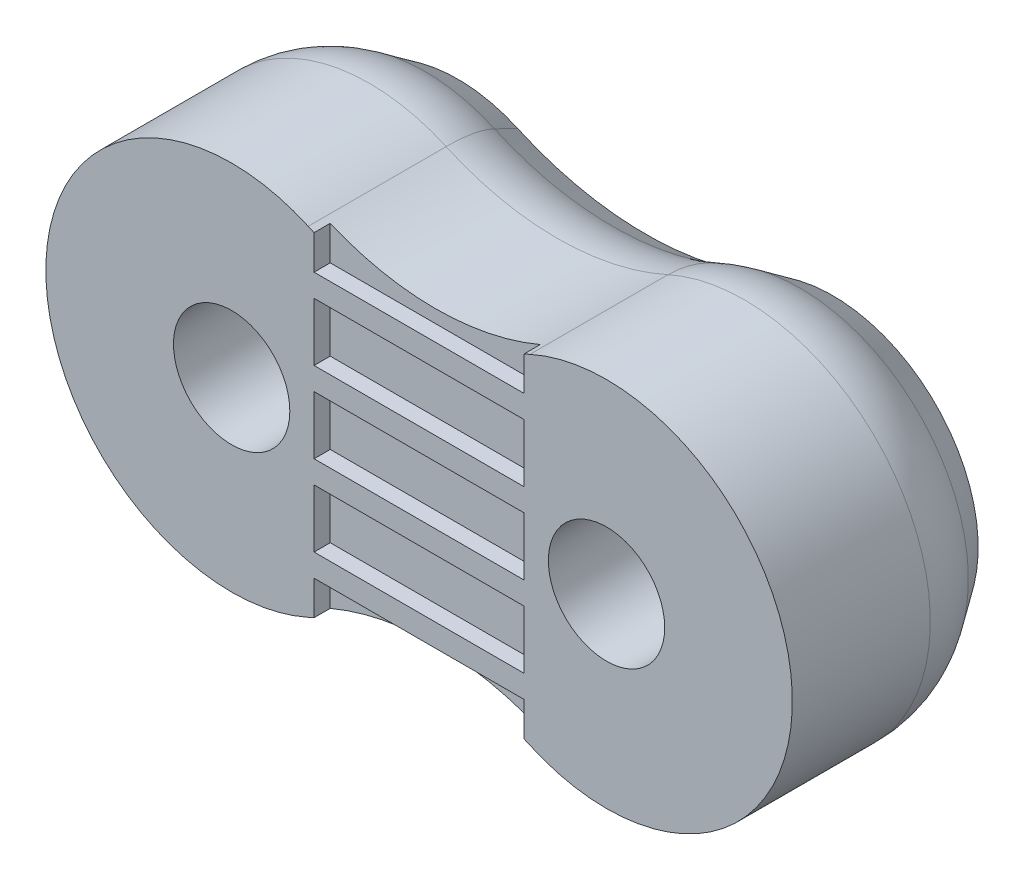
from build123d import *

# Parameters (mm, degrees)
BOSS_EXTRUDE1_DEPTH = 7
SKETCH5_R           = 1.799999865
SKETCH5_R_2         = 1.8
CUT_EXTRUDE4_DEPTH  = 18.482133737
SKETCH2_W           = 6.5
SKETCH2_H           = 1.8
CUT_EXTRUDE1_DEPTH  = 0.5
CUT_EXTRUDE5_DEPTH  = 2.5
CHAMFER1_SIZE       = 1.25
CHAMFER1_SIZE2      = 1.785185008
FILLET1_R           = 3
BOSS_EXTRUDE2_START = -0.6
SKETCH7_R           = 1.799999865
SKETCH7_R_2         = 1.8
BOSS_EXTRUDE2_DEPTH = 0.6
SKETCH8_R           = 1.399999865
SKETCH8_R_2         = 0.599999865
SKETCH8_R_3         = 1.4
SKETCH8_R_4         = 0.6
BOSS_EXTRUDE3_DEPTH = 2.5


with BuildPart() as part:
    # Sketch1 → Boss-Extrude1 (new body)
    with BuildSketch(Plane.XY):
        with BuildLine():
            ThreePointArc((6.631560259, -5.739560401), (3.2, -5), (-0.231560259, -5.739560401))
            ThreePointArc((-0.231560259, -5.739560401), (-8.35, -0.5), (-0.231560259, 4.739560401))
            ThreePointArc((-0.231560259, 4.739560401), (3.2, 4), (6.631560259, 4.739560401))
            ThreePointArc((6.631560259, 4.739560401), (14.75, -0.5), (6.631560259, -5.739560401))
        make_face()
    extrude(amount=-BOSS_EXTRUDE1_DEPTH)

    # Sketch5 → Cut-Extrude4 (cut, through all)
    with BuildSketch(Plane.XY):
        with Locations((9, -0.5)):
            Circle(SKETCH5_R)
        with Locations((-2.6, -0.5)):
            Circle(SKETCH5_R_2)
    extrude(amount=-CUT_EXTRUDE4_DEPTH, mode=Mode.SUBTRACT)

    # Sketch2 → Cut-Extrude1 (cut)
    with BuildSketch(Plane.XY):
        with Locations((3.200000135, 2)):
            Rectangle(SKETCH2_W, SKETCH2_H)
        with Locations((3.200000135, -0.5)):
            Rectangle(SKETCH2_W, SKETCH2_H)
        with BuildLine():
            Line((6.450000135, -4.6), (-0.049999865, -4.6))
            Line((-0.049999865, -4.6), (-0.049999865, -5.660076856))
            ThreePointArc((-0.049999865, -5.660076856), (3.200000146, -5), (6.450000135, -5.660076971))
            Line((6.450000135, -5.660076971), (6.450000135, -4.6))
        make_face()
        with Locations((3.200000135, -3)):
            Rectangle(SKETCH2_W, SKETCH2_H)
        with BuildLine():
            Line((6.450000135, 3.6), (6.450000135, 4.660076971))
            ThreePointArc((6.450000135, 4.660076971), (3.200000146, 4), (-0.049999865, 4.660076856))
            Line((-0.049999865, 4.660076856), (-0.049999865, 3.6))
            Line((-0.049999865, 3.6), (6.450000135, 3.6))
        make_face()
    extrude(amount=-CUT_EXTRUDE1_DEPTH, mode=Mode.SUBTRACT)

    # Sketch6 → Cut-Extrude5 (cut)
    with BuildSketch(Plane(origin=(0, 0, -7), x_dir=(-1, 0, 0), z_dir=(0, 0, -1))):
        Polygon((-0.979571669, -0.5), (0.810214166, -3.6), (4.389785834, -3.6), (6.179571669, -0.5), (4.389785834, 2.6), (0.810214166, 2.6), align=None)
        Polygon((-5.420428331, -0.5), (-7.210214166, 2.6), (-10.789785834, 2.6), (-12.579571669, -0.5), (-10.789785834, -3.6), (-7.210214166, -3.6), align=None)
    extrude(amount=-CUT_EXTRUDE5_DEPTH, mode=Mode.SUBTRACT)

    # Chamfer1
    chamfer1_edges = [part.edges().sort_by_distance(p)[0] for p in [
        (-8.35, -0.5, -7),
        (3.2, -5, -7),
        (14.75, -0.5, -7),
        (3.2, 4, -7),
    ]]
    chamfer1_side = [part.faces().sort_by_distance(p)[0] for p in [
        (3.2, -0.5, -7),
    ]]
    chamfer(chamfer1_edges, length=CHAMFER1_SIZE, length2=CHAMFER1_SIZE2, reference=chamfer1_side[0])

    # Fillet1
    # the kernel refuses this fillet: 3 mm, written as the material it takes off along each edge
    with BuildSketch(Plane(origin=(9, -0.5, -5.214814992), x_dir=(-0.41190256373837064, 0.9112278957460408, 0), z_dir=(-0.9112278957460408, -0.41190256373837064, 0))) as fillet1_piece_1:
        with BuildLine():
            CenterArc((5.75 - FILLET1_R, -FILLET1_R * 0.315298788879), FILLET1_R, 0, 35)
            Line((5.75 - FILLET1_R * 0.180847955711, FILLET1_R * 0.258277647472), (5.75, 0))
            Line((5.75, 0), (5.75, -FILLET1_R * 0.315298788879))
        make_face()
    fillet1_piece_1_solid = revolve(axis=Axis((9, -0.5, -5.214814992), (0, 0, -1)), revolution_arc=228.648814079, mode=Mode.PRIVATE)
    with BuildSketch(Plane(origin=(3.2, 12.331, -5.214814992), x_dir=(-0.41190256373837086, -0.9112278957460408, 0), z_dir=(-0.9112278957460408, 0.41190256373837086, 0))) as fillet1_piece_2:
        with BuildLine():
            CenterArc((8.331 + FILLET1_R, FILLET1_R * 0.315298788879), FILLET1_R, 180, 35)
            Line((8.331 + FILLET1_R * 0.180847955711, -FILLET1_R * 0.258277647472), (8.331, 0))
            Line((8.331, 0), (8.331, FILLET1_R * 0.315298788879))
        make_face()
    fillet1_piece_2_solid = revolve(axis=Axis((3.2, 12.331, -5.214814992), (0, 0, 1)), revolution_arc=48.648814079, mode=Mode.PRIVATE)
    with BuildSketch(Plane(origin=(3.2, -13.331, -5.214814992), x_dir=(0.41190256373837153, 0.9112278957460405, 0), z_dir=(0.9112278957460405, -0.41190256373837153, 0))) as fillet1_piece_3:
        with BuildLine():
            CenterArc((8.331 + FILLET1_R, FILLET1_R * 0.315298788879), FILLET1_R, 180, 35)
            Line((8.331 + FILLET1_R * 0.180847955711, -FILLET1_R * 0.258277647472), (8.331, 0))
            Line((8.331, 0), (8.331, FILLET1_R * 0.315298788879))
        make_face()
    fillet1_piece_3_solid = revolve(axis=Axis((3.2, -13.331, -5.214814992), (0, 0, 1)), revolution_arc=48.648814079, mode=Mode.PRIVATE)
    with BuildSketch(Plane(origin=(-2.6, -0.5, -5.214814992), x_dir=(0.41190256373837075, -0.9112278957460408, 0), z_dir=(0.9112278957460408, 0.41190256373837075, 0))) as fillet1_piece_4:
        with BuildLine():
            CenterArc((5.75 - FILLET1_R, -FILLET1_R * 0.315298788879), FILLET1_R, 0, 35)
            Line((5.75 - FILLET1_R * 0.180847955711, FILLET1_R * 0.258277647472), (5.75, 0))
            Line((5.75, 0), (5.75, -FILLET1_R * 0.315298788879))
        make_face()
    fillet1_piece_4_solid = revolve(axis=Axis((-2.6, -0.5, -5.214814992), (0, 0, -1)), revolution_arc=228.648814079, mode=Mode.PRIVATE)
    add([fillet1_piece_1_solid, fillet1_piece_2_solid, fillet1_piece_3_solid, fillet1_piece_4_solid], mode=Mode.SUBTRACT)

    # Sketch7 → Boss-Extrude2 (add)
    with BuildSketch(Plane(origin=(0, 0, -4.5), x_dir=(-1, 0, 0), z_dir=(0, 0, -1)).offset(BOSS_EXTRUDE2_START)):
        with Locations(Location((-9, -0.5, 0), (0, 0, 180))):
            Circle(SKETCH7_R)
        with Locations(Location((2.6, -0.5, 0), (0, 0, 180))):
            Circle(SKETCH7_R_2)
    extrude(amount=BOSS_EXTRUDE2_DEPTH)

    # Sketch8 → Boss-Extrude3 (add)
    # profile 1 of 2: a face of its own
    with BuildSketch(Plane(origin=(0, 0, -4.5), x_dir=(-1, 0, 0), z_dir=(0, 0, -1))):
        with Locations(Location((-9, -0.5, 0), (0, 0, 180))):
            Circle(SKETCH8_R)
        with Locations(Location((-9, -0.5, 0), (0, 0, 180))):
            Circle(SKETCH8_R_2, mode=Mode.SUBTRACT)
    # profile 2 of 2: a face of its own
    with BuildSketch(Plane(origin=(0, 0, -4.5), x_dir=(-1, 0, 0), z_dir=(0, 0, -1))):
        with Locations(Location((2.6, -0.5, 0), (0, 0, 180))):
            Circle(SKETCH8_R_3)
        with Locations(Location((2.6, -0.5, 0), (0, 0, 180))):
            Circle(SKETCH8_R_4, mode=Mode.SUBTRACT)
    extrude(amount=BOSS_EXTRUDE3_DEPTH)


solid = part.part
